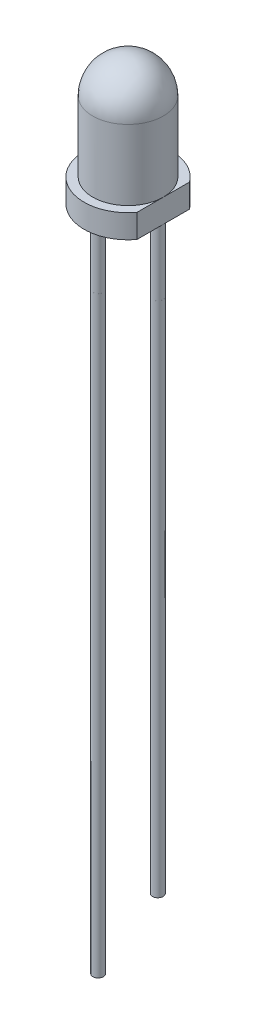
from build123d import *

# Parameters (mm, degrees)
RESSALTO_EXTRUS_O1_DEPTH = 1
ESBO_O3_R                = 0.225
RESSALTO_EXTRUS_O3_DEPTH = 29
ESBO_O4_R                = 0.225
RESSALTO_EXTRUS_O4_DEPTH = 24.775


# Read off the part's stored shape, not the designer's step: Ressalto-extrusão2
with BuildPart() as part:
    # Esboço1 → Ressalto-extrusão1 (new body)
    with BuildSketch(Plane.XZ):
        with BuildLine():
            Line((1.5, -1.116646766), (1.5, 1.116646766))
            ThreePointArc((1.5, 1.116646766), (-1.87, 0), (1.5, -1.116646766))
        make_face()
    extrude(amount=-RESSALTO_EXTRUS_O1_DEPTH)

    # Ressalto-extrusão2 outline → Ressalto-extrusão2 (revolve)
    with BuildSketch(Plane.XY):
        with BuildLine():
            Line((1.5, 1), (1.5, 3.99))
            ThreePointArc((1.5, 3.99), (1.060660172, 5.050660172), (0, 5.49))
            Line((0, 5.49), (0, 1))
            Line((0, 1), (1.5, 1))
        make_face()
    revolve(axis=Axis((0, 0, 0), (0, 1, 0)))

    # Esboço3 → Ressalto-extrusão3 (add)
    with BuildSketch(Plane.XZ):
        with Locations(Location((-1.27, 0, 0), (0, 0, 270))):
            Circle(ESBO_O3_R)
    extrude(amount=RESSALTO_EXTRUS_O3_DEPTH)

    # Esboço4 → Ressalto-extrusão4 (add)
    with BuildSketch(Plane.XZ):
        with Locations(Location((1.27, 0, 0), (0, 0, 270))):
            Circle(ESBO_O4_R)
    extrude(amount=RESSALTO_EXTRUS_O4_DEPTH)


solid = part.part
